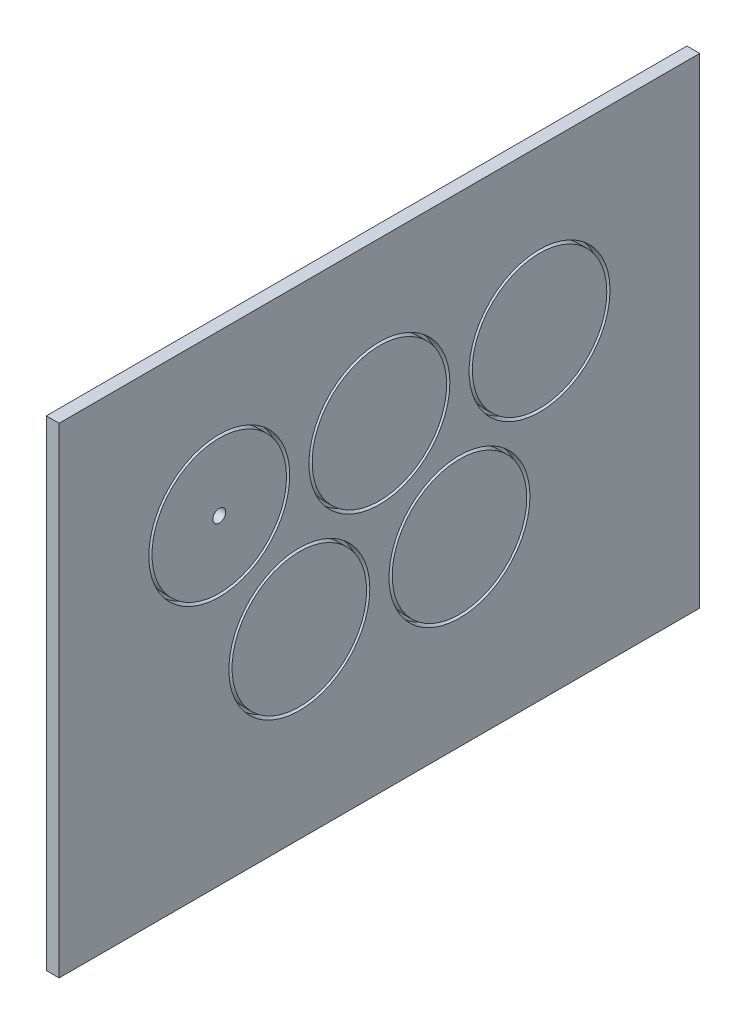
from build123d import *

# Parameters (mm, degrees)
MAIN_BOARD_W          = 1000
MAIN_BOARD_H          = 750
MAINBOARD_DEPTH       = 20
CUT_EXTRUDE9_REACH    = 627.32
SKETCH5_R             = 10
SKETCH5_8_R           = 110
SKETCH5_8_R_2         = 105
CUT_EXTRUDE10_DEPTH   = 15
LPATTERN1_START       = 5
LPATTERN1_OUTLINE_R   = 110
LPATTERN1_OUTLINE_R_2 = 105
LPATTERN1_DEPTH       = 15


# Read off the part's stored shape, not the designer's step: LPattern1
with BuildPart() as part:
    # Main Board → MainBoard (new body)
    with BuildSketch(Plane(origin=(0, 0, 0), x_dir=(0, 0, -1), z_dir=(1, 0, 0))):
        Rectangle(MAIN_BOARD_W, MAIN_BOARD_H)
    extrude(amount=MAINBOARD_DEPTH)

    # Sketch5 → Cut-Extrude9 (cut, up to next)
    with BuildSketch(Plane(origin=(20, 0, 0), x_dir=(0, 0, -1), z_dir=(1, 0, 0)), mode=Mode.PRIVATE) as cut_extrude9_sk1:
        with Locations((-250, 125)):
            Circle(SKETCH5_R)
    cut_extrude9_tool1 = extrude(cut_extrude9_sk1.sketch, amount=-CUT_EXTRUDE9_REACH, mode=Mode.PRIVATE) & part.part
    add(cut_extrude9_tool1.solids().sort_by_distance((20, 125, 250))[0], mode=Mode.SUBTRACT)

    # Sketch5<8> → Cut-Extrude10 (cut)
    with BuildSketch(Plane(origin=(20, 0, 0), x_dir=(0, 0, -1), z_dir=(1, 0, 0))):
        with Locations((-250, 125)):
            Circle(SKETCH5_8_R)
        with Locations((-250, 125)):
            Circle(SKETCH5_8_R_2, mode=Mode.SUBTRACT)
    extrude(amount=-CUT_EXTRUDE10_DEPTH, mode=Mode.SUBTRACT)

    # LPattern1 outline → LPattern1 (cut)
    # profile 1 of 4: a face of its own
    with BuildSketch(Plane.YZ.offset(LPATTERN1_START)):
        with Locations((-91, 125)):
            Circle(LPATTERN1_OUTLINE_R)
        with Locations((-91, 125)):
            Circle(LPATTERN1_OUTLINE_R_2, mode=Mode.SUBTRACT)
    # profile 2 of 4: a face of its own
    with BuildSketch(Plane.YZ.offset(LPATTERN1_START)):
        with Locations((125, -250)):
            Circle(LPATTERN1_OUTLINE_R)
        with Locations((125, -250)):
            Circle(LPATTERN1_OUTLINE_R_2, mode=Mode.SUBTRACT)
    # profile 3 of 4: a face of its own
    with BuildSketch(Plane.YZ.offset(LPATTERN1_START)):
        with Locations((125, 0)):
            Circle(LPATTERN1_OUTLINE_R)
        with Locations((125, 0)):
            Circle(LPATTERN1_OUTLINE_R_2, mode=Mode.SUBTRACT)
    # profile 4 of 4: a face of its own
    with BuildSketch(Plane.YZ.offset(LPATTERN1_START)):
        with Locations((-91, -125)):
            Circle(LPATTERN1_OUTLINE_R)
        with Locations((-91, -125)):
            Circle(LPATTERN1_OUTLINE_R_2, mode=Mode.SUBTRACT)
    extrude(amount=LPATTERN1_DEPTH, mode=Mode.SUBTRACT)


solid = part.part
